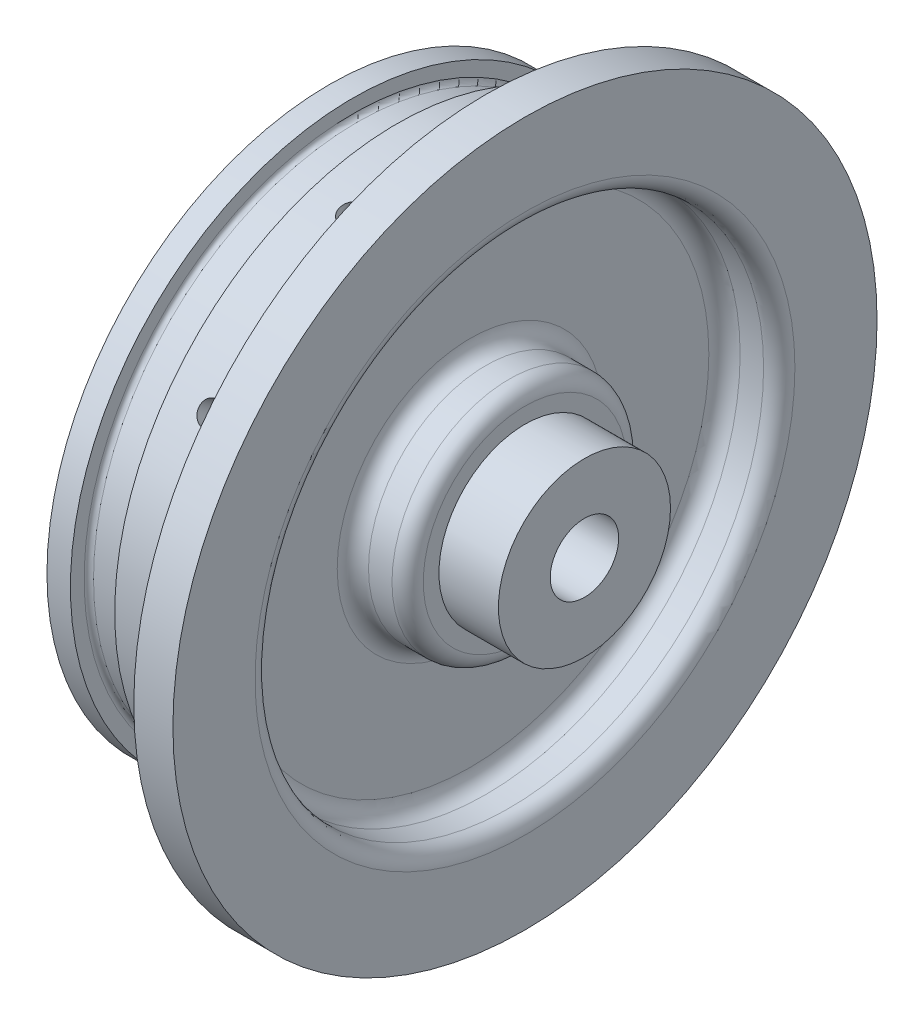
from build123d import *

# Parameters (mm, degrees)
SKETCH1_R               = 57.15
BOSS_EXTRUDE1_DEPTH     = 6.35
SKETCH2_R               = 45.847
BOSS_EXTRUDE2_DEPTH     = 25.4
SKETCH11_R              = 1.89865
CUT_EXTRUDE3_DEPTH      = 10.16
CIRPATTERN1_COUNT       = 10
CUT_EXTRUDE4_DEPTH      = 87.83494404
CUT_EXTRUDE4_DEPTH_BACK = 87.83494404
SKETCH15_R              = 5.55625
BOSS_EXTRUDE3_START     = 9.652
SKETCH17_R              = 13.97
SKETCH17_R_2            = 5.55625
BOSS_EXTRUDE3_DEPTH     = 9.652
SKETCH18_W              = 8.89
SKETCH18_H              = 22.225
FILLET1_R               = 2.54


with BuildPart() as part:
    # Sketch1 → Boss-Extrude1 (new body)
    with BuildSketch(Plane(origin=(0, 0, 0), x_dir=(0, 0, -1), z_dir=(1, 0, 0))):
        Circle(SKETCH1_R)
    extrude(amount=BOSS_EXTRUDE1_DEPTH)

    # Sketch2 → Boss-Extrude2 (add)
    with BuildSketch(Plane.ZY):
        Circle(SKETCH2_R)
    extrude(amount=BOSS_EXTRUDE2_DEPTH)

    # Sketch11 → Cut-Extrude3 (cut)
    with BuildSketch(Plane(origin=(0, 0, -45.847), x_dir=(-1, 0, 0), z_dir=(0, 0, -1))):
        with Locations((7.62, 0)):
            Circle(SKETCH11_R)
    cut_extrude3 = extrude(amount=-CUT_EXTRUDE3_DEPTH, mode=Mode.SUBTRACT)

    # CirPattern1: Cut-Extrude3 ×10 about axis
    cirpattern1_axis = Axis((0, 0, 0), (-1, 0, 0))
    for i in range(1, CIRPATTERN1_COUNT):
        add(cut_extrude3.rotate(cirpattern1_axis, i * 360 / CIRPATTERN1_COUNT), mode=Mode.SUBTRACT)

    # Sketch15 → Cut-Extrude4 (cut, two sides: drawn at the far end of the back side and taken through both)
    with BuildSketch(Plane(origin=(6.35, 0, 0), x_dir=(0, 0, -1), z_dir=(1, 0, 0)).offset(-CUT_EXTRUDE4_DEPTH_BACK)):
        Circle(SKETCH15_R)
    extrude(amount=CUT_EXTRUDE4_DEPTH + CUT_EXTRUDE4_DEPTH_BACK, mode=Mode.SUBTRACT)

    # Sketch16 → Cut-Revolve1 (revolve, cut)
    with BuildSketch(Plane.XY):
        with BuildLine():
            Line((-21.59, 45.847), (-14.4018, 45.847))
            Line((-14.4018, 45.847), (-14.4018, 43.6245))
            ThreePointArc((-14.4018, 43.6245), (-14.624984633, 43.085684633), (-15.1638, 42.8625))
            Line((-15.1638, 42.8625), (-20.828, 42.8625))
            ThreePointArc((-20.828, 42.8625), (-21.366815367, 43.085684633), (-21.59, 43.6245))
            Line((-21.59, 43.6245), (-21.59, 45.847))
        make_face()
    revolve(axis=Axis((0, 0, 0), (-1, 0, 0)), mode=Mode.SUBTRACT)

    # Sketch17 → Boss-Extrude3 (add)
    with BuildSketch(Plane(origin=(6.35, 0, 0), x_dir=(0, 0, -1), z_dir=(1, 0, 0)).offset(BOSS_EXTRUDE3_START)):
        Circle(SKETCH17_R)
        Circle(SKETCH17_R_2, mode=Mode.SUBTRACT)
    extrude(amount=-BOSS_EXTRUDE3_DEPTH)

    # Sketch18 → Cut-Revolve2 (revolve, cut)
    with BuildSketch(Plane.XY):
        with Locations((1.905, 30.1625)):
            Rectangle(SKETCH18_W, SKETCH18_H)
    revolve(axis=Axis((0, 0, 0), (-1, 0, 0)), mode=Mode.SUBTRACT)

    # Fillet1
    fillet1_edges = [part.edges().sort_by_distance(p)[0] for p in [
        (6.35, -41.275, 0),
        (-2.54, -41.275, 0),
        (-2.54, -19.05, 0),
        (6.35, -19.05, 0),
    ]]
    fillet(fillet1_edges, radius=FILLET1_R)


solid = part.part
